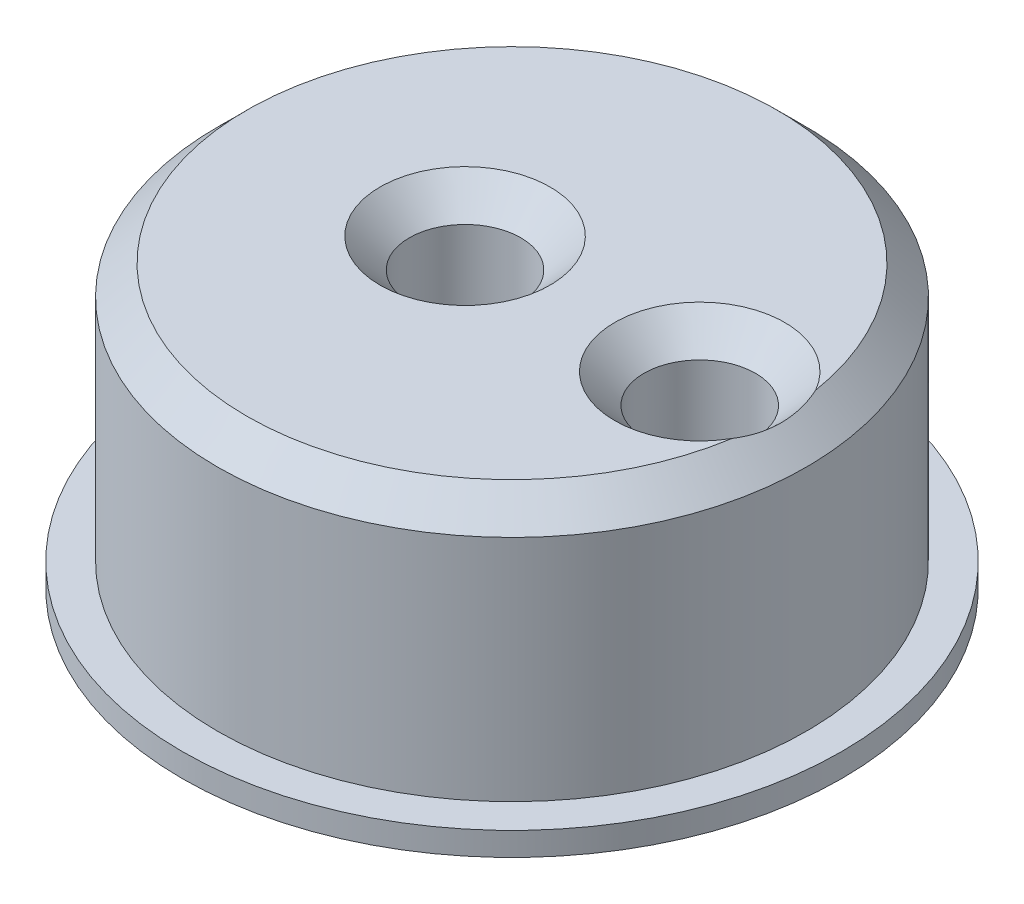
from build123d import *
from build123d.topology import SkipClean

# Parameters (mm, degrees)
SKETCH_1_R      = 5.02
SKETCH_1_R_2    = 0.95
EXTRUDE_1_DEPTH = 4.4
EXTRUDE_START   = 0.4
SKETCH_3_R      = 5.62
SKETCH_3_R_2    = 0.95
EXTRUDE_2_DEPTH = 0.4
CHAMFER_1_SIZE  = 0.5


with BuildPart() as part:
    # 草图1 → 凸台-拉伸1 (new body)
    with BuildSketch(Plane(origin=(0, 0, 0), x_dir=(1, 0, 0), z_dir=(0, 1, 0))):
        with Locations(Location((0, 0, 0), (0, 0, 270))):
            Circle(SKETCH_1_R)
        with Locations(Location((3.2, 0, 0), (0, 0, 270))):
            Circle(SKETCH_1_R_2, mode=Mode.SUBTRACT)
        with Locations(Location((-0.8, 0, 0), (0, 0, 90))):
            Circle(SKETCH_1_R_2, mode=Mode.SUBTRACT)
    extrude(amount=EXTRUDE_1_DEPTH)

    # 草图3 → 凸台-拉伸2 (add)
    with SkipClean():  # the faces are left unmerged after this step: merging them gives an invalid solid
        with BuildSketch(Plane.XZ.offset(EXTRUDE_START)):
            with Locations(Location((0, 0, 0), (0, 0, 270))):
                Circle(SKETCH_3_R)
            with Locations(Location((3.2, 0, 0), (0, 0, 270))):
                Circle(SKETCH_3_R_2, mode=Mode.SUBTRACT)
            with Locations(Location((-0.8, 0, 0), (0, 0, 270))):
                Circle(SKETCH_3_R_2, mode=Mode.SUBTRACT)
        extrude(amount=-EXTRUDE_2_DEPTH)

    # 倒角1
    # the kernel refuses this chamfer: 0.5 mm, written as the material it takes off along each edge
    with BuildSketch(Plane(origin=(3.2, -0.4, 0), x_dir=(0, 0, -1), z_dir=(-1, 0, 0))) as chamfer_1_piece_1:
        Polygon((0.95 + CHAMFER_1_SIZE, 0), (0.95, -CHAMFER_1_SIZE), (0.95, 0), align=None)
    revolve(axis=Axis((3.2, -0.4, 0), (0, -1, 0)), mode=Mode.SUBTRACT)
    with BuildSketch(Plane(origin=(-0.8, -0.4, 0), x_dir=(0, 0, -1), z_dir=(-1, 0, 0))) as chamfer_1_piece_2:
        Polygon((0.95 + CHAMFER_1_SIZE, 0), (0.95, -CHAMFER_1_SIZE), (0.95, 0), align=None)
    revolve(axis=Axis((-0.8, -0.4, 0), (0, -1, 0)), mode=Mode.SUBTRACT)
    with BuildSketch(Plane(origin=(0, 4.4, 0), x_dir=(0, 0, 1), z_dir=(-1, 0, 0))) as chamfer_1_piece_3:
        Polygon((5.02, -CHAMFER_1_SIZE), (5.02 - CHAMFER_1_SIZE, 0), (5.02, 0), align=None)
    revolve(axis=Axis((0, 4.4, 0), (0, 1, 0)), mode=Mode.SUBTRACT)
    with BuildSketch(Plane(origin=(3.2, 4.4, 0), x_dir=(0, 0, 1), z_dir=(-1, 0, 0))) as chamfer_1_piece_4:
        Polygon((0.95 + CHAMFER_1_SIZE, 0), (0.95, -CHAMFER_1_SIZE), (0.95, 0), align=None)
    revolve(axis=Axis((3.2, 4.4, 0), (0, 1, 0)), mode=Mode.SUBTRACT)
    with BuildSketch(Plane(origin=(-0.8, 4.4, 0), x_dir=(0, 0, -1), z_dir=(1, 0, 0))) as chamfer_1_piece_5:
        Polygon((0.95 + CHAMFER_1_SIZE, 0), (0.95, -CHAMFER_1_SIZE), (0.95, 0), align=None)
    revolve(axis=Axis((-0.8, 4.4, 0), (0, 1, 0)), mode=Mode.SUBTRACT)


solid = part.part
